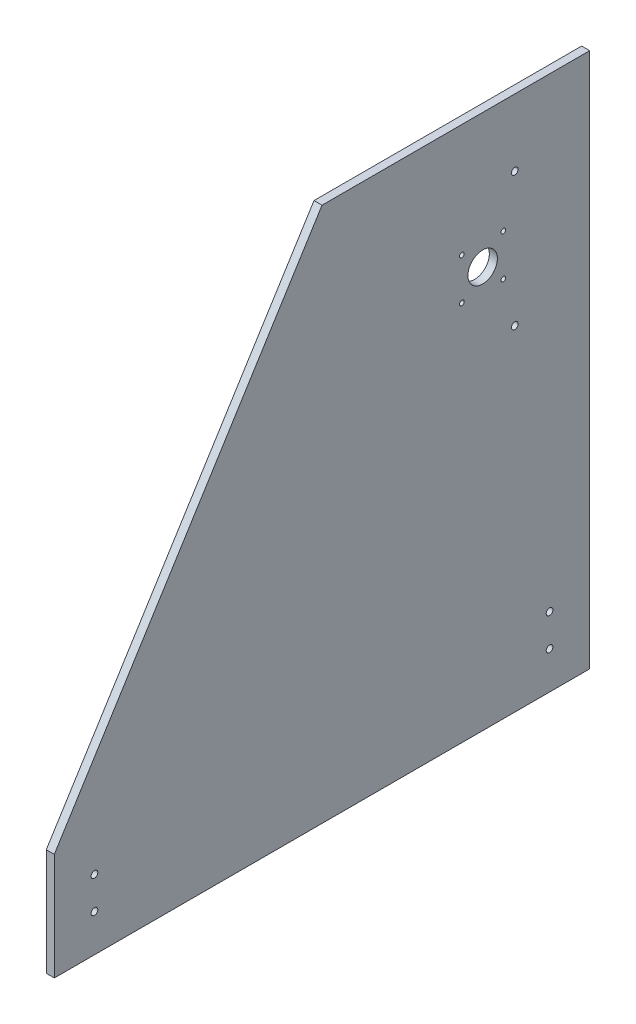
from build123d import *

# Parameters (mm, degrees)
SKETCH1_R           = 2.5
SKETCH1_R_2         = 11
SKETCH1_R_3         = 1.75
BOSS_EXTRUDE1_DEPTH = 6


with BuildPart() as part:
    # Sketch1 → Boss-Extrude1 (new body)
    with BuildSketch(Plane(origin=(0, 0, 0), x_dir=(0, 0, -1), z_dir=(1, 0, 0))):
        Polygon((0, 0), (400, 0), (400, 400), (200, 400), (0, 80), align=None)
        with Locations((30, 52)):
            Circle(SKETCH1_R, mode=Mode.SUBTRACT)
        with Locations((30, 28)):
            Circle(SKETCH1_R, mode=Mode.SUBTRACT)
        with Locations((370, 28)):
            Circle(SKETCH1_R, mode=Mode.SUBTRACT)
        with Locations((370, 52)):
            Circle(SKETCH1_R, mode=Mode.SUBTRACT)
        with Locations((344, 350)):
            Circle(SKETCH1_R, mode=Mode.SUBTRACT)
        with Locations((344, 250)):
            Circle(SKETCH1_R, mode=Mode.SUBTRACT)
        with Locations((320, 300)):
            Circle(SKETCH1_R_2, mode=Mode.SUBTRACT)
        with Locations((335.5, 315.5)):
            Circle(SKETCH1_R_3, mode=Mode.SUBTRACT)
        with Locations((304.5, 315.5)):
            Circle(SKETCH1_R_3, mode=Mode.SUBTRACT)
        with Locations((304.5, 284.5)):
            Circle(SKETCH1_R_3, mode=Mode.SUBTRACT)
        with Locations((335.5, 284.5)):
            Circle(SKETCH1_R_3, mode=Mode.SUBTRACT)
    extrude(amount=BOSS_EXTRUDE1_DEPTH)


solid = part.part
